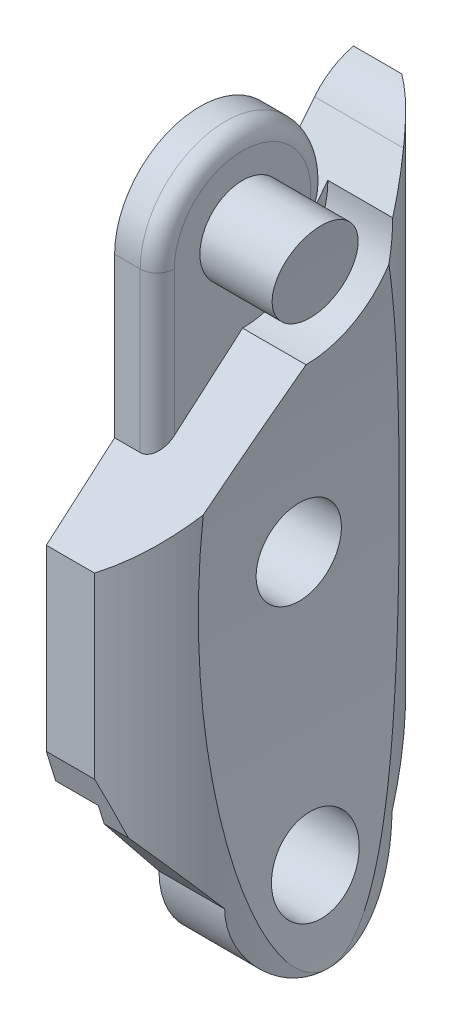
from build123d import *

# Parameters (mm, degrees)
BOSS_EXTRUDE1_DEPTH      = 40
CUT_EXTRUDE1_DEPTH       = 45
CUT_EXTRUDE2_REACH       = 47.222
SKETCH3_W                = 12
SKETCH3_H                = 10
SKETCH4_R                = 2.55
CUT_EXTRUDE3_DEPTH       = 17.5
FILLET4_R                = 2
CUT_EXTRUDE5_START       = -12.324555
SKETCH6_R                = 2.5
CUT_EXTRUDE5_DEPTH       = 9.6
CUT_EXTRUDE6_START       = 6.279445
SKETCH6_3_R              = 2.5
CUT_EXTRUDE6_DEPTH       = 6.604
CUT_EXTRUDE7_START       = -14.986
CUT_EXTRUDE7_DEPTH       = 14.986
CUT_EXTRUDE14_DEPTH      = 10
CUT_EXTRUDE14_DEPTH_BACK = 20
FILLET3_R                = 1
CUT_EXTRUDE17_DEPTH      = 9
CUT_EXTRUDE17_DEPTH_BACK = 31
SKETCH19_W               = 34.391960709
SKETCH19_H               = 80.468832088
SKETCH20_R               = 3.25
BOSS_EXTRUDE2_DEPTH      = 2
SKETCH21_R               = 1.5
CUT_EXTRUDE18_DEPTH      = 14
CUT_EXTRUDE19_START      = -4
SKETCH22_R               = 2.5
CUT_EXTRUDE19_DEPTH      = 14
CUT_EXTRUDE20_DEPTH      = 14
CUT_EXTRUDE20_DEPTH_BACK = 14


with BuildPart() as part:
    # Sketch1 → Boss-Extrude1 (new body)
    with BuildSketch(Plane(origin=(0, 0, 0), x_dir=(1, 0, 0), z_dir=(0, 1, 0))):
        with BuildLine():
            Line((-6.32455532, 9), (6.32455532, 9))
            ThreePointArc((6.32455532, 9), (11, 0), (6.32455532, -9))
            Line((6.32455532, -9), (-6.32455532, -9))
            ThreePointArc((-6.32455532, -9), (-11, 0), (-6.32455532, 9))
        make_face()
    extrude(amount=BOSS_EXTRUDE1_DEPTH)

    # Sketch2 → Cut-Extrude1 (cut)
    with BuildSketch(Plane.XZ):
        with BuildLine():
            Line((1.5, 5), (-1.5, 5))
            ThreePointArc((-1.5, 5), (0, 6.5), (1.5, 5))
        make_face()
        with BuildLine():
            Line((1.5, -5), (-1.5, -5))
            ThreePointArc((-1.5, -5), (0, -6.5), (1.5, -5))
        make_face()
    extrude(amount=-CUT_EXTRUDE1_DEPTH, mode=Mode.SUBTRACT)

    # Cut-Extrude2: up to this face of the body (flat: up to its plane)
    cut_extrude2_end = Plane(part.part.faces().sort_by_distance((0, 20, 9))[0])
    # Sketch3 → Cut-Extrude2 (cut, up to the picked face)
    with BuildSketch(Plane(origin=(0, 0, -9), x_dir=(-1, 0, 0), z_dir=(0, 0, -1)), mode=Mode.PRIVATE) as cut_extrude2_sk1:
        with Locations((0, 5)):
            Rectangle(SKETCH3_W, SKETCH3_H)
    cut_extrude2_tool1 = split(extrude(cut_extrude2_sk1.sketch, amount=-CUT_EXTRUDE2_REACH, mode=Mode.PRIVATE), bisect_by=cut_extrude2_end, keep=Keep.BOTH, mode=Mode.PRIVATE)
    add(cut_extrude2_tool1.solids().sort_by(Axis((0, 5, -9), (0, 0, 1)))[0], mode=Mode.SUBTRACT)

    # Sketch4 → Cut-Extrude3 (cut, symmetric)
    with BuildSketch(Plane.ZY.offset(-6)):
        with Locations(Location((0, 4.9, 0), (0, 0, 270))):
            Circle(SKETCH4_R)
        with BuildLine():
            Line((-9, 10), (-4.9, 4.9))
            ThreePointArc((-4.9, 4.9), (0, 0), (4.9, 4.9))
            Line((4.9, 4.9), (9, 10))
            Line((9, 10), (12.043777938, -1.930413563))
            Line((12.043777938, -1.930413563), (-10.290438773, -1.930413563))
            Line((-10.290438773, -1.930413563), (-9, 10))
        make_face()
    extrude(amount=CUT_EXTRUDE3_DEPTH, both=True, mode=Mode.SUBTRACT)

    # Fillet4
    fillet4_edges = [part.edges().sort_by_distance(p)[0] for p in [
        (0, 10, 5),
        (0, 10, 6.5),
        (0, 10, -5),
        (0, 10, -6.5),
    ]]
    fillet(fillet4_edges, radius=FILLET4_R)

    # Sketch6 → Cut-Extrude5 (cut)
    with BuildSketch(Plane.ZY.offset(6.32455532).offset(CUT_EXTRUDE5_START)):
        with BuildLine():
            Line((9, 22.232353468), (0, 30))
            ThreePointArc((0, 30), (-3.535533906, 31.464466094), (-5, 35))
            Line((-5, 35), (-6.715621335, 37.134065563))
            ThreePointArc((-6.715621335, 37.134065563), (-7.737273484, 38.043034193), (-9, 38.567933069))
            Line((-9, 38.567933069), (-20.985236203, 70.297327945))
            Line((-20.985236203, 70.297327945), (29.827478779, 37.594689174))
            Line((29.827478779, 37.594689174), (9, 22.232353468))
        make_face()
        with Locations((0, 35)):
            Circle(SKETCH6_R, mode=Mode.SUBTRACT)
    extrude(amount=-CUT_EXTRUDE5_DEPTH, mode=Mode.SUBTRACT)

    # Sketch6<3> → Cut-Extrude6 (cut)
    with BuildSketch(Plane.ZY.offset(6.32455532).offset(CUT_EXTRUDE6_START)):
        with BuildLine():
            Line((9, 22.232353468), (0, 30))
            ThreePointArc((0, 30), (-3.535533906, 31.464466094), (-5, 35))
            Line((-5, 35), (-6.715621335, 37.134065563))
            ThreePointArc((-6.715621335, 37.134065563), (-7.737273484, 38.043034193), (-9, 38.567933069))
            Line((-9, 38.567933069), (-20.985236203, 70.297327945))
            Line((-20.985236203, 70.297327945), (29.827478779, 37.594689174))
            Line((29.827478779, 37.594689174), (9, 22.232353468))
        make_face()
        with Locations((0, 35)):
            Circle(SKETCH6_3_R, mode=Mode.SUBTRACT)
    extrude(amount=-CUT_EXTRUDE6_DEPTH, mode=Mode.SUBTRACT)

    # Sketch7 → Cut-Extrude7 (cut)
    with BuildSketch(Plane(origin=(6, 0, 0), x_dir=(0, 0, -1), z_dir=(1, 0, 0)).offset(CUT_EXTRUDE7_START)):
        with BuildLine():
            Line((5, 35), (6.715621335, 37.134065563))
            ThreePointArc((6.715621335, 37.134065563), (7.737273484, 38.043034193), (9, 38.567933069))
            Line((9, 38.567933069), (17.905522107, 46.18977372))
            Line((17.905522107, 46.18977372), (-20.628346566, 40.15215478))
            Line((-20.628346566, 40.15215478), (-9, 22.232353468))
            Line((-9, 22.232353468), (-5, 25.684640815))
            Line((-5, 25.684640815), (-5, 35))
            ThreePointArc((-5, 35), (0, 40), (5, 35))
        make_face()
    extrude(amount=CUT_EXTRUDE7_DEPTH, mode=Mode.SUBTRACT)

    # Sketch16 → Cut-Extrude14 (cut, two sides: drawn at the far end of the back side and taken through both)
    with BuildSketch(Plane.ZY.offset(6.32455532).offset(-CUT_EXTRUDE14_DEPTH_BACK)):
        Polygon((8.113259987, 8.896981935), (11.550119513, 20.031417135), (18.056002312, 15.695207893), (16.156055326, 2.281594324), align=None)
    extrude(amount=CUT_EXTRUDE14_DEPTH + CUT_EXTRUDE14_DEPTH_BACK, mode=Mode.SUBTRACT)

    # Fillet3
    # the kernel refuses this fillet: 1 mm, written as the material it takes off along each edge
    with BuildSketch(Plane(origin=(5.99999968, 23.184640014, 5), x_dir=(-1, 0, 0), z_dir=(0, 1, 0))) as fillet3_piece_1_section:
        with BuildLine():
            CenterArc((FILLET3_R, -FILLET3_R), FILLET3_R, 90, 90)
            Line((0, -FILLET3_R), (0, 0))
            Line((0, 0), (FILLET3_R, 0))
        make_face()
    fillet3_piece_1 = extrude(amount=11.815359986, mode=Mode.PRIVATE)
    fillet3_piece_1 = split(fillet3_piece_1, bisect_by=Plane(origin=(5.764976342, 27.542151825, 2.84779096), z_dir=(0, 0.7570343753275036, 0.6533750489362878)), keep=Keep.TOP, mode=Mode.PRIVATE)
    add(fillet3_piece_1, mode=Mode.SUBTRACT)
    with BuildSketch(Plane(origin=(6, 35, 0), x_dir=(0, 0, 1), z_dir=(0, -1, 0))) as fillet3_piece_2_section:
        with BuildLine():
            CenterArc((4, 1.00000032), FILLET3_R, 270, 90)
            ThreePointArc((4, 3.2e-07), (4.5, 3.2e-07), (5, 0))
            Line((5, 0), (5, 1.00000032))
        make_face()
    fillet3_piece_2 = revolve(axis=Axis((6, 35, 0), (-1, 0, 0)), revolution_arc=208.693968336, mode=Mode.PRIVATE)
    fillet3_piece_2 = split(fillet3_piece_2, bisect_by=Plane(origin=(5.717618036, 35.865387036, -5.695703303), z_dir=(0, 0.6265569118246621, 0.7793756708062823)), keep=Keep.TOP, mode=Mode.PRIVATE)
    add(fillet3_piece_2, mode=Mode.SUBTRACT)
    with BuildSketch(Plane(origin=(-6.00000032, 35, 0), x_dir=(0, -0.48013104288571345, -0.8771967747646346), z_dir=(0, -0.8771967747646346, 0.48013104288571345))) as fillet3_piece_3_section:
        with BuildLine():
            CenterArc((5 - FILLET3_R, FILLET3_R), FILLET3_R, 270, 90)
            Line((5 - FILLET3_R, 0), (5, 0))
            Line((5, 0), (5, FILLET3_R))
        make_face()
    fillet3_piece_3 = revolve(axis=Axis((-6.00000032, 35, 0), (1, 0, 0)), revolution_arc=208.69396098, mode=Mode.PRIVATE)
    fillet3_piece_3 = split(fillet3_piece_3, bisect_by=Plane(origin=(-5.717618693, 35.865387047, -5.695703312), z_dir=(0, 0.6265569118246621, 0.7793756708062823)), keep=Keep.TOP, mode=Mode.PRIVATE)
    add(fillet3_piece_3, mode=Mode.SUBTRACT)
    with BuildSketch(Plane(origin=(-6.00000032, 35, 5), x_dir=(0, 0, -1), z_dir=(0, -1, 0))) as fillet3_piece_4_section:
        with BuildLine():
            CenterArc((FILLET3_R, FILLET3_R), FILLET3_R, 180, 90)
            Line((0, FILLET3_R), (0, 0))
            Line((0, 0), (FILLET3_R, 0))
        make_face()
    fillet3_piece_4 = extrude(amount=11.815359185, mode=Mode.PRIVATE)
    fillet3_piece_4 = split(fillet3_piece_4, bisect_by=Plane(origin=(-5.831638788, 29.468233541, 0.616132326), z_dir=(0, 0.7570343753275036, 0.6533750489362878)), keep=Keep.TOP, mode=Mode.PRIVATE)
    add(fillet3_piece_4, mode=Mode.SUBTRACT)

    # Sketch19 → Cut-Extrude17 (cut, two sides: drawn at the far end of the back side and taken through both)
    with BuildSketch(Plane.XY.offset(5).offset(-CUT_EXTRUDE17_DEPTH_BACK)):
        with Locations((-13.695980355, 34.702359308)):
            Rectangle(SKETCH19_W, SKETCH19_H)
    extrude(amount=CUT_EXTRUDE17_DEPTH + CUT_EXTRUDE17_DEPTH_BACK, mode=Mode.SUBTRACT)

    # Sketch20 → Boss-Extrude2 (add)
    with BuildSketch(Plane.ZY.offset(-3.5)):
        with Locations(Location((0, 20.3, 0), (0, 0, 270))):
            Circle(SKETCH20_R)
    extrude(amount=BOSS_EXTRUDE2_DEPTH)

    # Sketch21 → Cut-Extrude18 (cut)
    with BuildSketch(Plane.ZY.offset(-1.5)):
        with Locations(Location((0, 20.3, 0), (0, 0, 270))):
            Circle(SKETCH21_R)
    extrude(amount=-CUT_EXTRUDE18_DEPTH, mode=Mode.SUBTRACT)

    # Sketch22 → Cut-Extrude19 (cut)
    with BuildSketch(Plane.ZY.offset(-1.5).offset(CUT_EXTRUDE19_START)):
        with Locations(Location((0, 20.3, 0), (0, 0, 270))):
            Circle(SKETCH22_R)
    extrude(amount=-CUT_EXTRUDE19_DEPTH, mode=Mode.SUBTRACT)

    # Sketch17 → Cut-Extrude20 (cut, two sides: drawn at the far end of the back side and taken through both)
    with BuildSketch(Plane.XY.offset(-CUT_EXTRUDE20_DEPTH_BACK)):
        with BuildLine():
            Line((11, 0), (25.575472319, 70.054686952))
            Line((25.575472319, 70.054686952), (-19.116979593, 73.080460091))
            Line((-19.116979593, 73.080460091), (-22.103338511, 10.056999989))
            Line((-22.103338511, 10.056999989), (-11, 0))
            ThreePointArc((-11, 0), (-9.292734081, 20), (-11, 40))
            Line((-11, 40), (-11, 54.709335657))
            Line((-11, 54.709335657), (1.039161205, 61.782229983))
            Line((1.039161205, 61.782229983), (17.277292868, 53.927851901))
            Line((17.277292868, 53.927851901), (11, 40))
            ThreePointArc((11, 40), (9.292734081, 20), (11, 0))
        make_face()
    extrude(amount=CUT_EXTRUDE20_DEPTH + CUT_EXTRUDE20_DEPTH_BACK, mode=Mode.SUBTRACT)


solid = part.part
